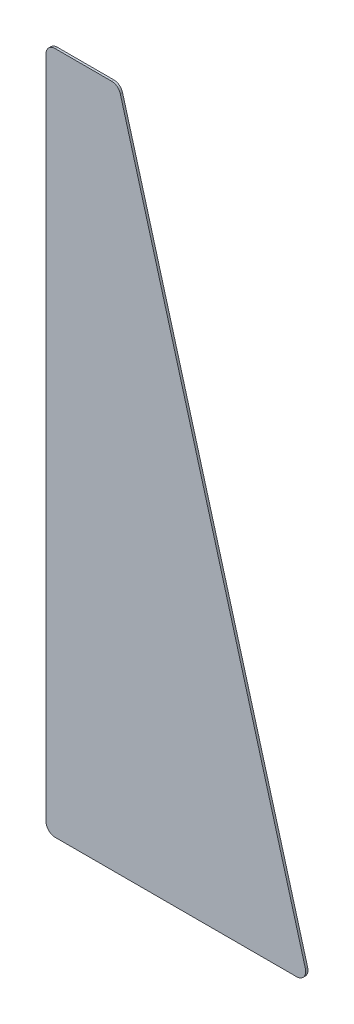
from build123d import *

# Parameters (mm, degrees)
BOSS_EXTRUDE1_DEPTH = 1.5875
FILLET1_R           = 6.35


with BuildPart() as part:
    # Sketch2 → Boss-Extrude1 (new body)
    with BuildSketch(Plane.XY):
        Polygon((0, 0), (0, 479.171), (50.8, 479.171), (184.15, 0), align=None)
    extrude(amount=BOSS_EXTRUDE1_DEPTH)

    # Fillet1
    fillet1_edges = [part.edges().sort_by_distance(p)[0] for p in [
        (0, 0, 0.79375),
        (50.8, 479.171, 0.79375),
        (0, 479.171, 0.79375),
        (184.15, 0, 0.79375),
    ]]
    fillet(fillet1_edges, radius=FILLET1_R)


solid = part.part
